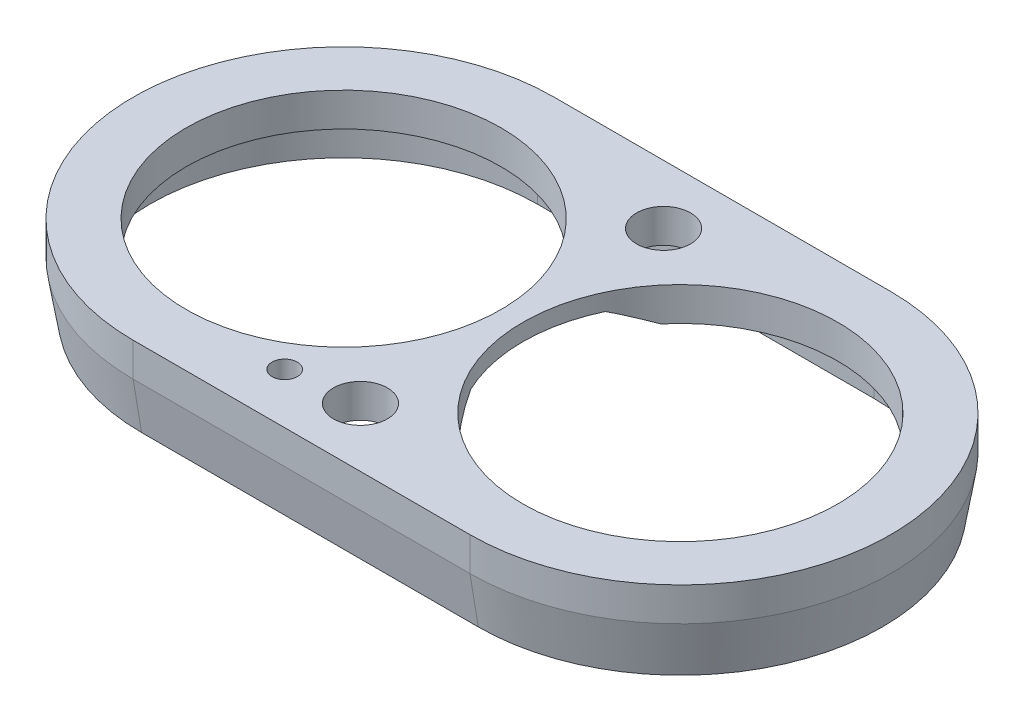
from build123d import *
from OCP.BRepFilletAPI import BRepFilletAPI_MakeChamfer

# Parameters (mm, degrees)
BOSS_EXTRUDE1_DEPTH = 2
SKETCH2_R           = 9.35
CUT_EXTRUDE1_DEPTH  = 26.816661287
BOSS_EXTRUDE3_START = 3
BOSS_EXTRUDE3_DEPTH = 3
CHAMFER1_SIZE       = 3
CHAMFER1_SIZE2      = 0.5
SKETCH5_W           = 15
SKETCH5_H           = 12
CUT_EXTRUDE3_DEPTH  = 1
CHAMFER2_SIZE       = 2
CHAMFER2_SIZE_2     = 1
SKETCH7_R           = 0.75
SKETCH7_R_2         = 1.6
CUT_EXTRUDE4_DEPTH  = 27.220221204


with BuildPart() as part:
    # Sketch1 → Boss-Extrude1 (new body)
    with BuildSketch(Plane(origin=(0, 0, 0), x_dir=(1, 0, 0), z_dir=(0, 1, 0))):
        with BuildLine():
            Line((10, -12.5), (-10, -12.5))
            ThreePointArc((-10, -12.5), (-22.5, 0), (-10, 12.5))
            Line((-10, 12.5), (10, 12.5))
            ThreePointArc((10, 12.5), (22.5, 0), (10, -12.5))
        make_face()
    extrude(amount=BOSS_EXTRUDE1_DEPTH)

    # Sketch2 → Cut-Extrude1 (cut, through all)
    with BuildSketch(Plane(origin=(0, 2, 0), x_dir=(1, 0, 0), z_dir=(0, 1, 0))):
        with Locations(Location((10, 0, 0), (0, 0, 270))):
            Circle(SKETCH2_R)
        with Locations(Location((-10, 0, 0), (0, 0, 90))):
            Circle(SKETCH2_R)
    extrude(amount=-CUT_EXTRUDE1_DEPTH, mode=Mode.SUBTRACT)

    # Sketch3 → Boss-Extrude3 (add)
    with BuildSketch(Plane.XZ.offset(BOSS_EXTRUDE3_START)):
        with BuildLine():
            Line((-10, -12.5), (10, -12.5))
            ThreePointArc((10, -12.5), (22.5, 0), (10, 12.5))
            Line((10, 12.5), (-10, 12.5))
            ThreePointArc((-10, 12.5), (-22.5, 0), (-10, -12.5))
        make_face()
        with BuildLine():
            Line((-10, -11.5), (10, -11.5))
            ThreePointArc((10, -11.5), (21.5, 0), (10, 11.5))
            Line((10, 11.5), (-10, 11.5))
            ThreePointArc((-10, 11.5), (-21.5, 0), (-10, -11.5))
        make_face(mode=Mode.SUBTRACT)
    extrude(amount=-BOSS_EXTRUDE3_DEPTH)

    # Chamfer1: one chamfer whose edges measure the first distance from different faces: ONE call of the kernel's chamfer builder (chamfer() names one face for all edges)
    chamfer1_edges_1 = [part.edges().sort_by_distance(p)[0] for p in [
        (22.5, -3, 0),
    ]]
    chamfer1_side_1 = [part.faces().sort_by_distance(p)[0] for p in [
        (22.5, -0.5, 0),
    ]]
    chamfer1_edges_2 = [part.edges().sort_by_distance(p)[0] for p in [
        (0, -3, 12.5),
    ]]
    chamfer1_side_2 = [part.faces().sort_by_distance(p)[0] for p in [
        (0, -0.5, 12.5),
    ]]
    chamfer1_edges_3 = [part.edges().sort_by_distance(p)[0] for p in [
        (-22.5, -3, 0),
    ]]
    chamfer1_side_3 = [part.faces().sort_by_distance(p)[0] for p in [
        (-22.5, -0.5, 0),
    ]]
    chamfer1_edges_4 = [part.edges().sort_by_distance(p)[0] for p in [
        (0, -3, -12.5),
    ]]
    chamfer1_side_4 = [part.faces().sort_by_distance(p)[0] for p in [
        (0, -0.5, -12.5),
    ]]
    chamfer1 = BRepFilletAPI_MakeChamfer(part.part.solid().wrapped)
    for e in chamfer1_edges_1:
        chamfer1.Add(CHAMFER1_SIZE, CHAMFER1_SIZE2, e.wrapped, chamfer1_side_1[0].wrapped)  # the first distance lies on this face
    for e in chamfer1_edges_2:
        chamfer1.Add(CHAMFER1_SIZE, CHAMFER1_SIZE2, e.wrapped, chamfer1_side_2[0].wrapped)  # the first distance lies on this face
    for e in chamfer1_edges_3:
        chamfer1.Add(CHAMFER1_SIZE, CHAMFER1_SIZE2, e.wrapped, chamfer1_side_3[0].wrapped)  # the first distance lies on this face
    for e in chamfer1_edges_4:
        chamfer1.Add(CHAMFER1_SIZE, CHAMFER1_SIZE2, e.wrapped, chamfer1_side_4[0].wrapped)  # the first distance lies on this face
    add(Compound.cast(chamfer1.Shape()), mode=Mode.REPLACE)

    # Sketch5 → Cut-Extrude3 (cut)
    with BuildSketch(Plane.XZ):
        Rectangle(SKETCH5_W, SKETCH5_H)
    extrude(amount=-CUT_EXTRUDE3_DEPTH, mode=Mode.SUBTRACT)

    # Chamfer2
    chamfer2_edges_1 = [part.edges().sort_by_distance(p)[0] for p in [
        (0, 1, -6),
    ]]
    chamfer2_side_1 = [part.faces().sort_by_distance(p)[0] for p in [
        (0, 1, -5.98),
    ]]
    chamfer2_edges_2 = [part.edges().sort_by_distance(p)[0] for p in [
        (0, 1, 6),
    ]]
    chamfer2_side_2 = [part.faces().sort_by_distance(p)[0] for p in [
        (0, 0.98, 6),
    ]]
    chamfer2 = BRepFilletAPI_MakeChamfer(part.part.solid().wrapped)
    for e in chamfer2_edges_1:
        chamfer2.Add(CHAMFER2_SIZE - 0.0001, CHAMFER2_SIZE_2 - 0.0001, e.wrapped, chamfer2_side_1[0].wrapped)
    for e in chamfer2_edges_2:
        chamfer2.Add(CHAMFER2_SIZE_2 - 0.0001, CHAMFER2_SIZE - 0.0001, e.wrapped, chamfer2_side_2[0].wrapped)
    add(Compound.cast(chamfer2.Shape()), mode=Mode.REPLACE)  # a hair under: the kernel refuses the full size

    # Sketch7 → Cut-Extrude4 (cut, through all)
    with BuildSketch(Plane(origin=(0, 2, 0), x_dir=(1, 0, 0), z_dir=(0, 1, 0))):
        with Locations(Location((-4, -9.5, 0), (0, 0, 270))):
            Circle(SKETCH7_R)
        with Locations(Location((0, -9, 0), (0, 0, 270))):
            Circle(SKETCH7_R_2)
        with Locations(Location((0, 9, 0), (0, 0, 270))):
            Circle(SKETCH7_R_2)
    extrude(amount=-CUT_EXTRUDE4_DEPTH, mode=Mode.SUBTRACT)


solid = part.part
